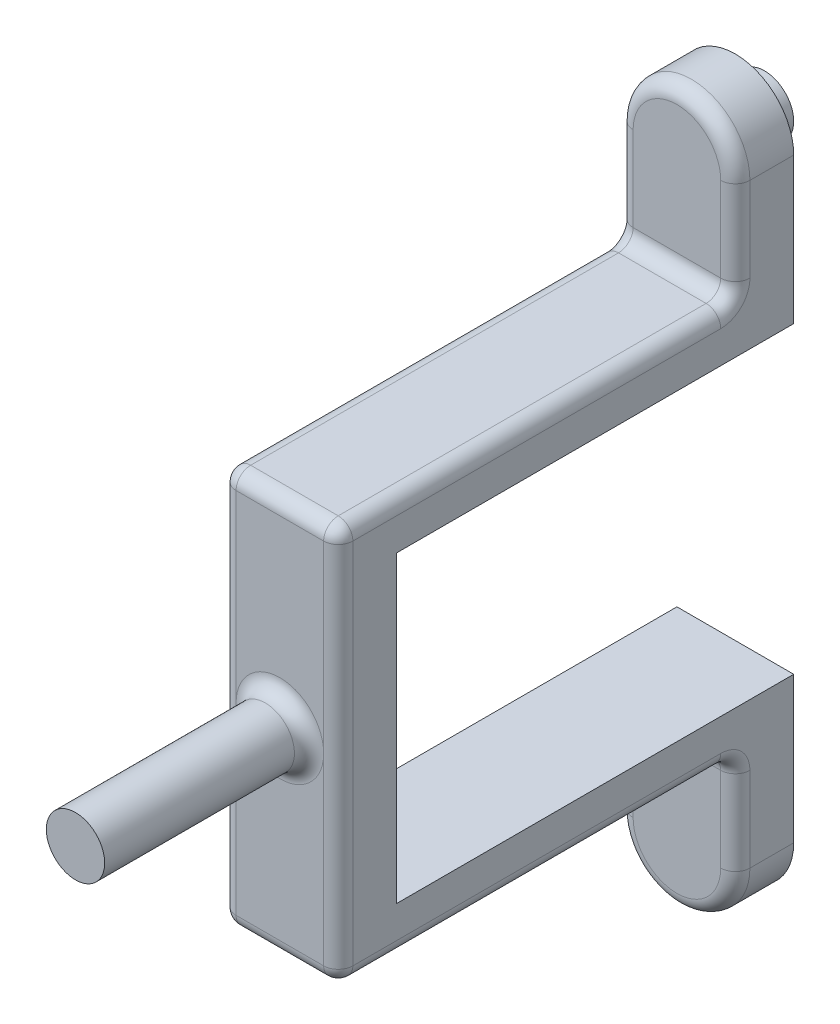
from build123d import *

# Parameters (mm, degrees)
BOSS_EXTRUDE1_DEPTH = 2.54
SKETCH1_7_W         = 5.08
SKETCH1_7_H         = 2.032
BOSS_EXTRUDE2_DEPTH = 17.272
SKETCH2_W           = 5.08
SKETCH2_H           = 17.272
BOSS_EXTRUDE3_DEPTH = 2.54
SKETCH3_R           = 1.27
BOSS_EXTRUDE4_DEPTH = 8.89
FILLET1_R           = 0.635
SKETCH4_R           = 1.27
BOSS_EXTRUDE5_DEPTH = 1.27


with BuildPart() as part:
    # Sketch1 → Boss-Extrude1 (new body)
    with BuildSketch(Plane.XY):
        with BuildLine():
            ThreePointArc((-78.760738581, 73.886338755), (-81.300738581, 71.346338755), (-83.840738581, 73.886338755))
            Line((-83.840738581, 73.886338755), (-83.840738581, 69.568338755))
            Line((-83.840738581, 69.568338755), (-78.760738581, 69.568338755))
            Line((-78.760738581, 69.568338755), (-78.760738581, 73.886338755))
        make_face()
        with BuildLine():
            ThreePointArc((-78.760738581, 73.886338755), (-81.300738581, 76.426338755), (-83.840738581, 73.886338755))
            Line((-83.840738581, 73.886338755), (-78.760738581, 73.886338755))
        make_face()
        with BuildLine():
            Line((-78.760738581, 73.886338755), (-83.840738581, 73.886338755))
            ThreePointArc((-83.840738581, 73.886338755), (-81.300738581, 71.346338755), (-78.760738581, 73.886338755))
        make_face()
        with BuildLine():
            ThreePointArc((-78.760738581, 47.978338755), (-81.300738581, 50.518338755), (-83.840738581, 47.978338755))
            Line((-83.840738581, 47.978338755), (-78.760738581, 47.978338755))
        make_face()
        with BuildLine():
            Line((-78.760738581, 47.978338755), (-83.840738581, 47.978338755))
            ThreePointArc((-83.840738581, 47.978338755), (-81.300738581, 45.438338755), (-78.760738581, 47.978338755))
        make_face()
        with BuildLine():
            Line((-78.760738581, 52.296338755), (-83.840738581, 52.296338755))
            Line((-83.840738581, 52.296338755), (-83.840738581, 47.978338755))
            ThreePointArc((-83.840738581, 47.978338755), (-81.300738581, 50.518338755), (-78.760738581, 47.978338755))
            Line((-78.760738581, 47.978338755), (-78.760738581, 52.296338755))
        make_face()
    extrude(amount=BOSS_EXTRUDE1_DEPTH)

    # Sketch1<7> → Boss-Extrude2 (add)
    with BuildSketch(Plane.XY):
        with Locations((-81.300738581, 53.312338755)):
            Rectangle(SKETCH1_7_W, SKETCH1_7_H)
        Polygon((-78.760738581, 69.568338755), (-83.840738581, 69.568338755), (-83.840738581, 67.536338755), (-82.574456105, 67.536338755), (-78.760738581, 67.536338755), align=None)
    extrude(amount=BOSS_EXTRUDE2_DEPTH)

    # Sketch2 → Boss-Extrude3 (add)
    with BuildSketch(Plane.XY.offset(17.272)):
        with Locations((-81.300738581, 60.932338755)):
            Rectangle(SKETCH2_W, SKETCH2_H)
    extrude(amount=BOSS_EXTRUDE3_DEPTH)

    # Sketch3 → Boss-Extrude4 (add)
    with BuildSketch(Plane.XY.offset(19.812)):
        with Locations(Location((-81.300738581, 60.932338755, 0), (0, 0, 180))):
            Circle(SKETCH3_R)
    extrude(amount=BOSS_EXTRUDE4_DEPTH)

    # Fillet1
    fillet1_edges = [part.edges().sort_by_distance(p)[0] for p in [
        (-81.300738581, 76.426338755, 2.54),
        (-83.840738581, 71.727338755, 2.54),
        (-78.760738581, 69.568338755, 11.176),
        (-83.840738581, 69.568338755, 11.176),
        (-81.300738581, 69.568338755, 2.54),
        (-83.840738581, 52.296338755, 11.176),
        (-78.760738581, 60.932338755, 19.812),
        (-78.760738581, 52.296338755, 11.176),
        (-81.300738581, 69.568338755, 19.812),
        (-81.300738581, 52.296338755, 19.812),
        (-83.840738581, 60.932338755, 19.812),
        (-81.300738581, 45.438338755, 2.54),
        (-83.840738581, 50.137338755, 2.54),
        (-78.760738581, 50.137338755, 2.54),
        (-81.300738581, 52.296338755, 2.54),
        (-78.760738581, 71.727338755, 2.54),
        (-80.030738581, 60.932338755, 19.812),
    ]]
    fillet(fillet1_edges, radius=FILLET1_R - 0.0001)  # a hair under: the kernel refuses the full size

    # Sketch4 → Boss-Extrude5 (add)
    with BuildSketch(Plane(origin=(0, 0, 0), x_dir=(-1, 0, 0), z_dir=(0, 0, -1))):
        with Locations(Location((81.300738581, 73.886338755, 0), (0, 0, 180))):
            Circle(SKETCH4_R)
        with Locations(Location((81.300738581, 47.978338755, 0), (0, 0, 180))):
            Circle(SKETCH4_R)
    extrude(amount=BOSS_EXTRUDE5_DEPTH)


solid = part.part
